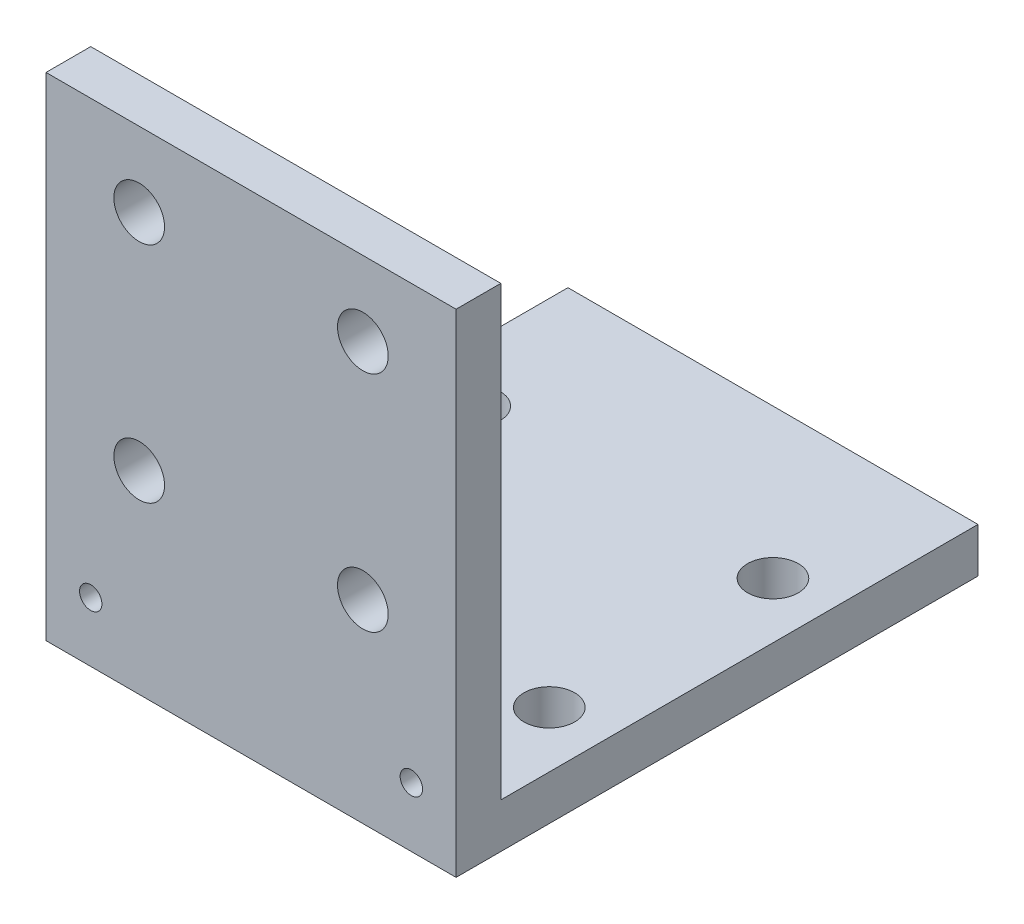
from build123d import *

# Parameters (mm, degrees)
SKETCH1_W                = 27.5
SKETCH1_H                = 3
BOSS_EXTRUDE1_DEPTH      = 35
SKETCH2_W                = 27.5
SKETCH2_H                = 3
BOSS_EXTRUDE2_DEPTH      = 40
M3_CLEARANCE_HOLE1_D     = 3.4
M3_CLEARANCE_HOLE1_DEPTH = 5
M3_CLEARANCE_HOLE1_TIP   = 1.021463052
SKETCH6_R                = 0.75
CUT_EXTRUDE1_DEPTH       = 10
M3_CLEARANCE_HOLE2_D     = 3.4
M3_CLEARANCE_HOLE2_DEPTH = 5
M3_CLEARANCE_HOLE2_TIP   = 1.021463052
SKETCH12_W               = 27.5
SKETCH12_H               = 10
CUT_EXTRUDE2_DEPTH       = 55.178524343


with BuildPart() as part:
    # Sketch1 → Boss-Extrude1 (new body)
    with BuildSketch(Plane.XY):
        Rectangle(SKETCH1_W, SKETCH1_H)
    extrude(amount=BOSS_EXTRUDE1_DEPTH)

    # Sketch2 → Boss-Extrude2 (add)
    with BuildSketch(Plane(origin=(0, 1.5, 0), x_dir=(1, 0, 0), z_dir=(0, 1, 0))):
        with Locations((0, -33.5)):
            Rectangle(SKETCH2_W, SKETCH2_H)
    extrude(amount=BOSS_EXTRUDE2_DEPTH)

    # M3 Clearance Hole1
    with Locations(Plane(origin=(0, 1.5, 0), x_dir=(1, 0, 0), z_dir=(0, 1, 0))):
        with Locations((-10, -10), (-10, -25), (10, -25), (10, -10)):
            Hole(M3_CLEARANCE_HOLE1_D / 2, depth=M3_CLEARANCE_HOLE1_DEPTH)
            with Locations((0, 0, -(M3_CLEARANCE_HOLE1_DEPTH + M3_CLEARANCE_HOLE1_TIP / 2))):  # 118° drill point
                Cone(0, M3_CLEARANCE_HOLE1_D / 2, M3_CLEARANCE_HOLE1_TIP, mode=Mode.SUBTRACT)

    # Sketch6 → Cut-Extrude1 (cut)
    with BuildSketch(Plane.XY.offset(35)):
        with Locations((-10.75, 2.5)):
            Circle(SKETCH6_R)
    cut_extrude1 = extrude(amount=-CUT_EXTRUDE1_DEPTH, mode=Mode.SUBTRACT)

    # M3 Clearance Hole2
    with Locations(Plane(origin=(0, 0, 32), x_dir=(-1, 0, 0), z_dir=(0, 0, -1))):
        with Locations((-7.5, 11.5), (7.5, 11.5), (7.5, 26.5), (-7.5, 26.5)):
            Hole(M3_CLEARANCE_HOLE2_D / 2, depth=M3_CLEARANCE_HOLE2_DEPTH)
            with Locations((0, 0, -(M3_CLEARANCE_HOLE2_DEPTH + M3_CLEARANCE_HOLE2_TIP / 2))):  # 118° drill point
                Cone(0, M3_CLEARANCE_HOLE2_D / 2, M3_CLEARANCE_HOLE2_TIP, mode=Mode.SUBTRACT)

    # Mirror1: Cut-Extrude1 across plane
    add(cut_extrude1.mirror(Plane(origin=(0, 0, 0), x_dir=(0, 0, 1), z_dir=(1, 0, 0))), mode=Mode.SUBTRACT)

    # Sketch12 → Cut-Extrude2 (cut, through all)
    with BuildSketch(Plane(origin=(0, 0, 32), x_dir=(-1, 0, 0), z_dir=(0, 0, -1))):
        with Locations((0, 36.5)):
            Rectangle(SKETCH12_W, SKETCH12_H)
    extrude(amount=-CUT_EXTRUDE2_DEPTH, mode=Mode.SUBTRACT)


solid = part.part
